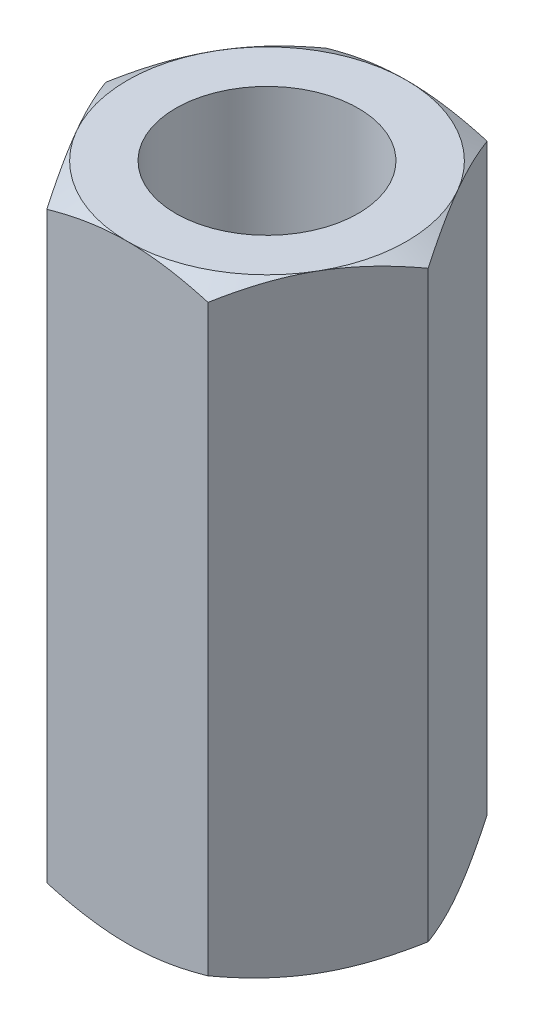
from build123d import *

# Parameters (mm, degrees)
SKETCH_1_R          = 1.5
EXTRUDE_1_DEPTH     = 10
SKETCH_2_OUTSIDE_W  = 49.914
SKETCH_2_OUTSIDE_H  = 49.204
SKETCH_2_OUTSIDE_R  = 2.29496732
CUT_EXTRUDE_1_DEPTH = 11.596668108
CUT_EXTRUDE_1_DRAFT = -60
SKETCH_3_OUTSIDE_W  = 49.914
SKETCH_3_OUTSIDE_H  = 49.204
SKETCH_3_OUTSIDE_R  = 2.29496732
CUT_EXTRUDE_2_DEPTH = 11.596668108
CUT_EXTRUDE_2_DRAFT = -60


with BuildPart() as part:
    # 草图1 → 凸台-拉伸1 (new body)
    with BuildSketch(Plane(origin=(0, 0, 0), x_dir=(1, 0, 0), z_dir=(0, 1, 0))):
        Polygon((1.325, 2.29496732), (-1.325, 2.29496732), (-2.65, 0), (-1.325, -2.29496732), (1.325, -2.29496732), (2.65, 0), align=None)
        Circle(SKETCH_1_R, mode=Mode.SUBTRACT)
    extrude(amount=EXTRUDE_1_DEPTH)


with BuildPart() as cut_extrude_1_tool:
    # 草图2 outside → 切除-拉伸1 (with draft: the straight prism first)
    with BuildSketch(Plane.XZ):
        Rectangle(SKETCH_2_OUTSIDE_W, SKETCH_2_OUTSIDE_H)
        Circle(SKETCH_2_OUTSIDE_R, mode=Mode.SUBTRACT)
    extrude(amount=-CUT_EXTRUDE_1_DEPTH)
    # 切除-拉伸1: the draft: its side faces are tilted about the plane it starts from
    cut_extrude_1_sides = [cut_extrude_1_tool.faces().sort_by_distance(p)[0] for p in [
        (0, 5.798334054, -24.602),
        (24.957, 5.798334054, 0),
        (0, 5.798334054, 24.602),
        (-24.957, 5.798334054, 0),
        (-2.29496732, 5.798334054, 0),
    ]]
    draft(cut_extrude_1_sides, Plane.XZ, CUT_EXTRUDE_1_DRAFT)


with BuildPart() as part_1:
    add(part.part)

    # 切除-拉伸1: cut by cut_extrude_1_tool
    add(cut_extrude_1_tool.part, mode=Mode.SUBTRACT)


with BuildPart() as cut_extrude_2_tool:
    # 草图3 outside → 切除-拉伸2 (with draft: the straight prism first)
    with BuildSketch(Plane(origin=(0, 10, 0), x_dir=(1, 0, 0), z_dir=(0, 1, 0))):
        Rectangle(SKETCH_3_OUTSIDE_W, SKETCH_3_OUTSIDE_H)
        Circle(SKETCH_3_OUTSIDE_R, mode=Mode.SUBTRACT)
    extrude(amount=-CUT_EXTRUDE_2_DEPTH)
    # 切除-拉伸2: the draft: its side faces are tilted about the plane it starts from
    cut_extrude_2_sides = [cut_extrude_2_tool.faces().sort_by_distance(p)[0] for p in [
        (0, 4.201665946, 24.602),
        (24.957, 4.201665946, 0),
        (0, 4.201665946, -24.602),
        (-24.957, 4.201665946, 0),
        (-2.29496732, 4.201665946, 0),
    ]]
    draft(cut_extrude_2_sides, Plane(origin=(0, 10, 0), x_dir=(1, 0, 0), z_dir=(0, 1, 0)), CUT_EXTRUDE_2_DRAFT)


with BuildPart() as part_2:
    add(part_1.part)

    # 切除-拉伸2: cut by cut_extrude_2_tool
    add(cut_extrude_2_tool.part, mode=Mode.SUBTRACT)


solid = part_2.part
